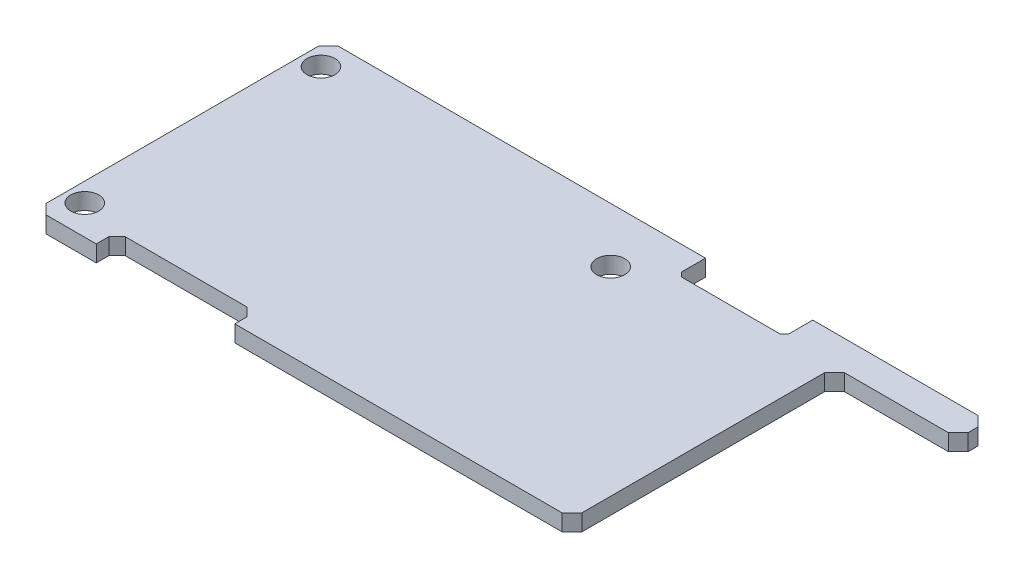
from build123d import *
from OCP.BRepFilletAPI import BRepFilletAPI_MakeChamfer

# Parameters (mm, degrees)
SKETCH_1_W          = 80
SKETCH_1_H          = 35.45
EXTRUDE_1_DEPTH     = 2
SKETCH_2_W          = 15
SKETCH_2_H          = 31.85
CUT_EXTRUDE_1_DEPTH = 88.525439159
SKETCH_3_R          = 1.7
CUT_EXTRUDE_2_DEPTH = 88.525439159
CUT_EXTRUDE_3_DEPTH = 88.525439159
CHAMFER_1_SIZE      = 1
CHAMFER_1_SIZE2     = 1.000209231
CHAMFER_1_SIZE2_2   = 0.9997909
CHAMFER_2_SIZE      = 1.2


with BuildPart() as part:
    # 草图1 → 凸台-拉伸1 (new body)
    with BuildSketch(Plane(origin=(0, 0, 0), x_dir=(1, 0, 0), z_dir=(0, 1, 0))):
        with Locations((40, 17.725)):
            Rectangle(SKETCH_1_W, SKETCH_1_H)
    extrude(amount=EXTRUDE_1_DEPTH)

    # 草图2 → 切除-拉伸1 (cut, through all)
    with BuildSketch(Plane(origin=(0, 2, 0), x_dir=(1, 0, 0), z_dir=(0, 1, 0))):
        with Locations((72.5, 15.925)):
            Rectangle(SKETCH_2_W, SKETCH_2_H)
    extrude(amount=-CUT_EXTRUDE_1_DEPTH, mode=Mode.SUBTRACT)

    # 草图3 → 切除-拉伸2 (cut, through all)
    with BuildSketch(Plane(origin=(0, 2, 0), x_dir=(1, 0, 0), z_dir=(0, 1, 0))):
        with Locations((2.3, 3.6)):
            Circle(SKETCH_3_R)
        with Locations((2.3, 32.25)):
            Circle(SKETCH_3_R)
        with Locations((40.890622301, 28.802547363)):
            Circle(SKETCH_3_R)
    extrude(amount=-CUT_EXTRUDE_2_DEPTH, mode=Mode.SUBTRACT)

    # 草图4 → 切除-拉伸3 (cut, through all)
    with BuildSketch(Plane(origin=(0, 2, 0), x_dir=(1, 0, 0), z_dir=(0, 1, 0))):
        Polygon((24.1, -2.079393675), (24.1, 2.510639533), (7.3, 2.514153517), (7.3, -2.079393675), align=None)
        Polygon((58.756633845, 37.528460969), (45.745241645, 37.528460969), (45.745241645, 32.56585445), (46.297622047, 32.013474049), (58.197670631, 32.00995017), (58.756633845, 32.56585445), align=None)
    extrude(amount=-CUT_EXTRUDE_3_DEPTH, mode=Mode.SUBTRACT)

    # 倒角1: one chamfer whose edges measure the first distance from different faces: ONE call of the kernel's chamfer builder (chamfer() names one face for all edges)
    chamfer_1_edges_1 = [part.edges().sort_by_distance(p)[0] for p in [
        (24.1, 1, -2.510639533),
    ]]
    chamfer_1_side_1 = [part.faces().sort_by_distance(p)[0] for p in [
        (15.7, 1, -2.512396525),
    ]]
    chamfer_1_edges_2 = [part.edges().sort_by_distance(p)[0] for p in [
        (7.3, 1, -2.514153517),
    ]]
    chamfer_1_side_2 = [part.faces().sort_by_distance(p)[0] for p in [
        (15.7, 1, -2.512396525),
    ]]
    chamfer_1 = BRepFilletAPI_MakeChamfer(part.part.solid().wrapped)
    for e in chamfer_1_edges_1:
        chamfer_1.Add(CHAMFER_1_SIZE, CHAMFER_1_SIZE2, e.wrapped, chamfer_1_side_1[0].wrapped)  # the first distance lies on this face
    for e in chamfer_1_edges_2:
        chamfer_1.Add(CHAMFER_1_SIZE, CHAMFER_1_SIZE2_2, e.wrapped, chamfer_1_side_2[0].wrapped)  # the first distance lies on this face
    add(Compound.cast(chamfer_1.Shape()), mode=Mode.REPLACE)

    # 倒角2
    chamfer_2_edges = [part.edges().sort_by_distance(p)[0] for p in [
        (65, 1, -31.85),
        (65, 1, 0),
        (80, 1, -31.85),
        (80, 1, -35.45),
        (0, 1, -35.45),
        (0, 1, 0),
    ]]
    chamfer(chamfer_2_edges, length=CHAMFER_2_SIZE)


solid = part.part
